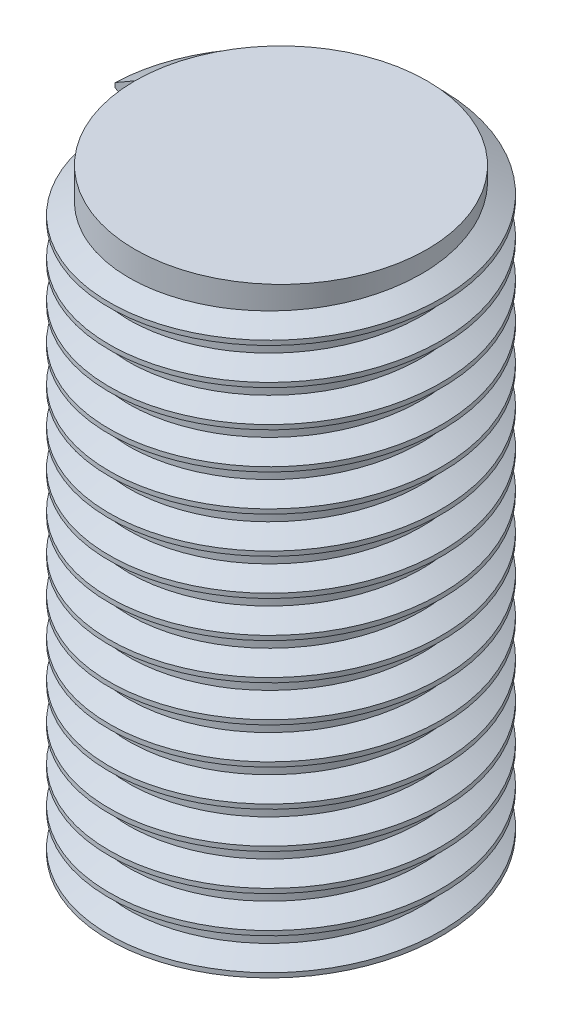
from build123d import *

# Parameters (mm, degrees)
SKETCH1_R           = 1
BOSS_EXTRUDE1_DEPTH = 4
THREAD1_PITCH       = 0.25


with BuildPart() as part:
    # Sketch1 → Boss-Extrude1 (new body)
    with BuildSketch(Plane(origin=(0, 0, 0), x_dir=(1, 0, 0), z_dir=(0, 1, 0))):
        with Locations(Location((0, 0, 0), (0, 0, 270))):
            Circle(SKETCH1_R)
    extrude(amount=BOSS_EXTRUDE1_DEPTH)

    # Thread1: the profile of Thread Profile1 profile screwed along a right-hand helix of 16 turns, 6 arcs to a turn; built about Z, then put on its axis
    thread1_z = Axis((0, 0, 0), (0, 0, 1))
    thread1_corners = [(0.9997, 0, -0.000173205), (1.135316469, 0, 0.078125), (1.135316469, 0, 0.109375), (0.9997, 0, 0.187673204)]
    with BuildLine(mode=Mode.PRIVATE) as thread1_profile:
        Line(thread1_corners[0], thread1_corners[1])
        Line(thread1_corners[1], thread1_corners[2])
        Line(thread1_corners[2], thread1_corners[3])
        Line(thread1_corners[3], thread1_corners[0])
    thread1_cap = Face(thread1_profile.wire())
    thread1_turn_angles = [0, 30, 60, 90, 120, 150, 180, 210, 240, 270, 300, 330, 360]
    thread1_turn_weights = [1, 0.8660254037844387, 1, 0.8660254037844387, 1, 0.8660254037844387, 1, 0.8660254037844387, 1, 0.8660254037844387, 1, 0.8660254037844387, 1]
    thread1_turn_rails = [Edge.make_bspline([Vector(p[0], p[1], 0).rotate(thread1_z, thread1_turn_angles[k]) / thread1_turn_weights[k] + Vector(0, 0, p[2] + THREAD1_PITCH * thread1_turn_angles[k] / 360) for k in range(13)], [0, 0, 0, 1, 1, 2, 2, 3, 3, 4, 4, 5, 5, 6, 6, 6], 2, thread1_turn_weights) for p in thread1_corners]
    thread1_turn_sides = [Face.make_surface_from_curves(thread1_turn_rails[p[0]], thread1_turn_rails[p[1]]) for p in [(0, 1), (1, 2), (2, 3), (3, 0)]]
    thread1 = Plane(origin=(0, 4, 0), x_dir=(-1, 0, 0), z_dir=(0, -1, 0)) * Solid(Shell([*[p.moved(Location((0, 0, THREAD1_PITCH * i))) for i in range(16) for p in thread1_turn_sides], thread1_cap, thread1_cap.rotate(thread1_z, 5760).moved(Location((0, 0, THREAD1_PITCH * 5760 / 360)))]))
    add(thread1)


solid = part.part
